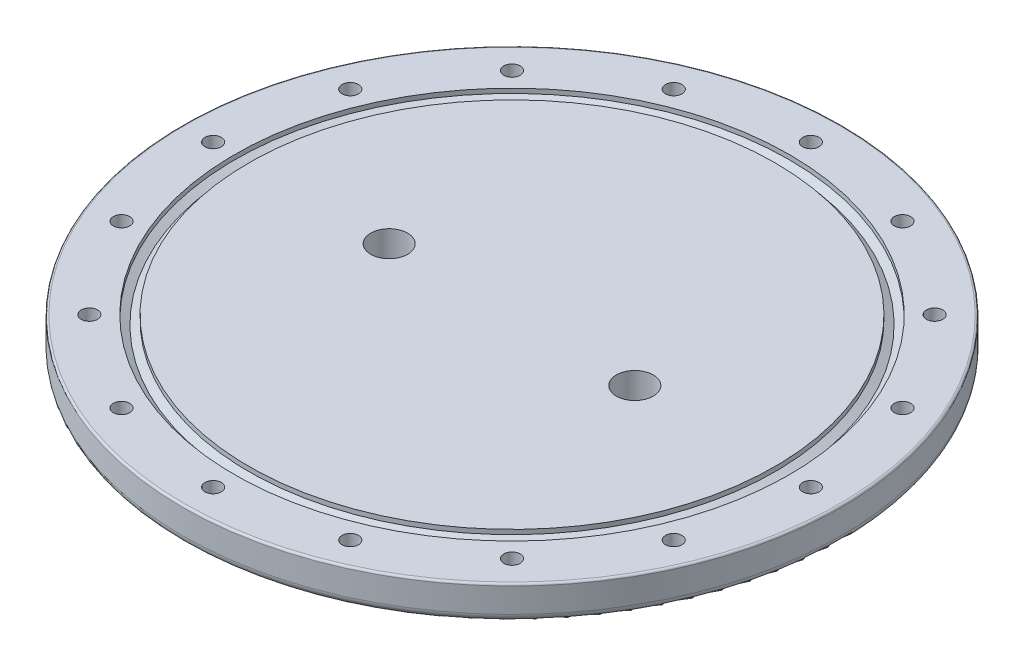
from build123d import *

# Parameters (mm, degrees)
SKETCH1_R           = 80.5
BOSS_EXTRUDE1_DEPTH = 8.5
CUT_EXTRUDE1_REACH  = 116.161
SKETCH2_R           = 2
CUT_EXTRUDE2_REACH  = 116.161
SKETCH5_R           = 4.5
FILLET1_R           = 2
FILLET2_R           = 0.5


with BuildPart() as part:
    # Sketch1 → Boss-Extrude1 (new body)
    with BuildSketch(Plane(origin=(0, 0, 0), x_dir=(1, 0, 0), z_dir=(0, 1, 0))):
        Circle(SKETCH1_R)
    extrude(amount=BOSS_EXTRUDE1_DEPTH)

    # Sketch2 → Cut-Extrude1 (cut, up to next)
    with BuildSketch(Plane(origin=(0, 8.5, 0), x_dir=(1, 0, 0), z_dir=(0, 1, 0)), mode=Mode.PRIVATE) as cut_extrude1_sk1:
        with Locations((0, 73)):
            Circle(SKETCH2_R)
    cut_extrude1_tool1 = extrude(cut_extrude1_sk1.sketch, amount=-CUT_EXTRUDE1_REACH, mode=Mode.PRIVATE) & part.part
    # Sketch2 → Cut-Extrude1 (cut, up to next)
    with BuildSketch(Plane(origin=(0, 8.5, 0), x_dir=(1, 0, 0), z_dir=(0, 1, 0)), mode=Mode.PRIVATE) as cut_extrude1_sk2:
        with Locations((27.935890563, 67.443205873)):
            Circle(SKETCH2_R)
    cut_extrude1_tool2 = extrude(cut_extrude1_sk2.sketch, amount=-CUT_EXTRUDE1_REACH, mode=Mode.PRIVATE) & part.part
    # Sketch2 → Cut-Extrude1 (cut, up to next)
    with BuildSketch(Plane(origin=(0, 8.5, 0), x_dir=(1, 0, 0), z_dir=(0, 1, 0)), mode=Mode.PRIVATE) as cut_extrude1_sk3:
        with Locations((51.618795027, 51.618795027)):
            Circle(SKETCH2_R)
    cut_extrude1_tool3 = extrude(cut_extrude1_sk3.sketch, amount=-CUT_EXTRUDE1_REACH, mode=Mode.PRIVATE) & part.part
    # Sketch2 → Cut-Extrude1 (cut, up to next)
    with BuildSketch(Plane(origin=(0, 8.5, 0), x_dir=(1, 0, 0), z_dir=(0, 1, 0)), mode=Mode.PRIVATE) as cut_extrude1_sk4:
        with Locations((67.443205873, 27.935890563)):
            Circle(SKETCH2_R)
    cut_extrude1_tool4 = extrude(cut_extrude1_sk4.sketch, amount=-CUT_EXTRUDE1_REACH, mode=Mode.PRIVATE) & part.part
    # Sketch2 → Cut-Extrude1 (cut, up to next)
    with BuildSketch(Plane(origin=(0, 8.5, 0), x_dir=(1, 0, 0), z_dir=(0, 1, 0)), mode=Mode.PRIVATE) as cut_extrude1_sk5:
        with Locations((73, 0)):
            Circle(SKETCH2_R)
    cut_extrude1_tool5 = extrude(cut_extrude1_sk5.sketch, amount=-CUT_EXTRUDE1_REACH, mode=Mode.PRIVATE) & part.part
    # Sketch2 → Cut-Extrude1 (cut, up to next)
    with BuildSketch(Plane(origin=(0, 8.5, 0), x_dir=(1, 0, 0), z_dir=(0, 1, 0)), mode=Mode.PRIVATE) as cut_extrude1_sk6:
        with Locations((67.443205873, -27.935890563)):
            Circle(SKETCH2_R)
    cut_extrude1_tool6 = extrude(cut_extrude1_sk6.sketch, amount=-CUT_EXTRUDE1_REACH, mode=Mode.PRIVATE) & part.part
    # Sketch2 → Cut-Extrude1 (cut, up to next)
    with BuildSketch(Plane(origin=(0, 8.5, 0), x_dir=(1, 0, 0), z_dir=(0, 1, 0)), mode=Mode.PRIVATE) as cut_extrude1_sk7:
        with Locations((51.618795027, -51.618795027)):
            Circle(SKETCH2_R)
    cut_extrude1_tool7 = extrude(cut_extrude1_sk7.sketch, amount=-CUT_EXTRUDE1_REACH, mode=Mode.PRIVATE) & part.part
    # Sketch2 → Cut-Extrude1 (cut, up to next)
    with BuildSketch(Plane(origin=(0, 8.5, 0), x_dir=(1, 0, 0), z_dir=(0, 1, 0)), mode=Mode.PRIVATE) as cut_extrude1_sk8:
        with Locations((27.935890563, -67.443205873)):
            Circle(SKETCH2_R)
    cut_extrude1_tool8 = extrude(cut_extrude1_sk8.sketch, amount=-CUT_EXTRUDE1_REACH, mode=Mode.PRIVATE) & part.part
    # Sketch2 → Cut-Extrude1 (cut, up to next)
    with BuildSketch(Plane(origin=(0, 8.5, 0), x_dir=(1, 0, 0), z_dir=(0, 1, 0)), mode=Mode.PRIVATE) as cut_extrude1_sk9:
        with Locations((0, -73)):
            Circle(SKETCH2_R)
    cut_extrude1_tool9 = extrude(cut_extrude1_sk9.sketch, amount=-CUT_EXTRUDE1_REACH, mode=Mode.PRIVATE) & part.part
    # Sketch2 → Cut-Extrude1 (cut, up to next)
    with BuildSketch(Plane(origin=(0, 8.5, 0), x_dir=(1, 0, 0), z_dir=(0, 1, 0)), mode=Mode.PRIVATE) as cut_extrude1_sk10:
        with Locations((-27.935890563, -67.443205873)):
            Circle(SKETCH2_R)
    cut_extrude1_tool10 = extrude(cut_extrude1_sk10.sketch, amount=-CUT_EXTRUDE1_REACH, mode=Mode.PRIVATE) & part.part
    # Sketch2 → Cut-Extrude1 (cut, up to next)
    with BuildSketch(Plane(origin=(0, 8.5, 0), x_dir=(1, 0, 0), z_dir=(0, 1, 0)), mode=Mode.PRIVATE) as cut_extrude1_sk11:
        with Locations((-51.618795027, -51.618795027)):
            Circle(SKETCH2_R)
    cut_extrude1_tool11 = extrude(cut_extrude1_sk11.sketch, amount=-CUT_EXTRUDE1_REACH, mode=Mode.PRIVATE) & part.part
    # Sketch2 → Cut-Extrude1 (cut, up to next)
    with BuildSketch(Plane(origin=(0, 8.5, 0), x_dir=(1, 0, 0), z_dir=(0, 1, 0)), mode=Mode.PRIVATE) as cut_extrude1_sk12:
        with Locations((-67.443205873, -27.935890563)):
            Circle(SKETCH2_R)
    cut_extrude1_tool12 = extrude(cut_extrude1_sk12.sketch, amount=-CUT_EXTRUDE1_REACH, mode=Mode.PRIVATE) & part.part
    # Sketch2 → Cut-Extrude1 (cut, up to next)
    with BuildSketch(Plane(origin=(0, 8.5, 0), x_dir=(1, 0, 0), z_dir=(0, 1, 0)), mode=Mode.PRIVATE) as cut_extrude1_sk13:
        with Locations((-73, 0)):
            Circle(SKETCH2_R)
    cut_extrude1_tool13 = extrude(cut_extrude1_sk13.sketch, amount=-CUT_EXTRUDE1_REACH, mode=Mode.PRIVATE) & part.part
    # Sketch2 → Cut-Extrude1 (cut, up to next)
    with BuildSketch(Plane(origin=(0, 8.5, 0), x_dir=(1, 0, 0), z_dir=(0, 1, 0)), mode=Mode.PRIVATE) as cut_extrude1_sk14:
        with Locations((-67.443205873, 27.935890563)):
            Circle(SKETCH2_R)
    cut_extrude1_tool14 = extrude(cut_extrude1_sk14.sketch, amount=-CUT_EXTRUDE1_REACH, mode=Mode.PRIVATE) & part.part
    # Sketch2 → Cut-Extrude1 (cut, up to next)
    with BuildSketch(Plane(origin=(0, 8.5, 0), x_dir=(1, 0, 0), z_dir=(0, 1, 0)), mode=Mode.PRIVATE) as cut_extrude1_sk15:
        with Locations((-51.618795027, 51.618795027)):
            Circle(SKETCH2_R)
    cut_extrude1_tool15 = extrude(cut_extrude1_sk15.sketch, amount=-CUT_EXTRUDE1_REACH, mode=Mode.PRIVATE) & part.part
    # Sketch2 → Cut-Extrude1 (cut, up to next)
    with BuildSketch(Plane(origin=(0, 8.5, 0), x_dir=(1, 0, 0), z_dir=(0, 1, 0)), mode=Mode.PRIVATE) as cut_extrude1_sk16:
        with Locations((-27.935890563, 67.443205873)):
            Circle(SKETCH2_R)
    cut_extrude1_tool16 = extrude(cut_extrude1_sk16.sketch, amount=-CUT_EXTRUDE1_REACH, mode=Mode.PRIVATE) & part.part
    add(cut_extrude1_tool1.solids().sort_by_distance((0, 8.5, -73))[0], mode=Mode.SUBTRACT)
    add(cut_extrude1_tool2.solids().sort_by_distance((27.935891, 8.5, -67.443206))[0], mode=Mode.SUBTRACT)
    add(cut_extrude1_tool3.solids().sort_by_distance((51.618795, 8.5, -51.618795))[0], mode=Mode.SUBTRACT)
    add(cut_extrude1_tool4.solids().sort_by_distance((67.443206, 8.5, -27.935891))[0], mode=Mode.SUBTRACT)
    add(cut_extrude1_tool5.solids().sort_by_distance((73, 8.5, 0))[0], mode=Mode.SUBTRACT)
    add(cut_extrude1_tool6.solids().sort_by_distance((67.443206, 8.5, 27.935891))[0], mode=Mode.SUBTRACT)
    add(cut_extrude1_tool7.solids().sort_by_distance((51.618795, 8.5, 51.618795))[0], mode=Mode.SUBTRACT)
    add(cut_extrude1_tool8.solids().sort_by_distance((27.935891, 8.5, 67.443206))[0], mode=Mode.SUBTRACT)
    add(cut_extrude1_tool9.solids().sort_by_distance((0, 8.5, 73))[0], mode=Mode.SUBTRACT)
    add(cut_extrude1_tool10.solids().sort_by_distance((-27.935891, 8.5, 67.443206))[0], mode=Mode.SUBTRACT)
    add(cut_extrude1_tool11.solids().sort_by_distance((-51.618795, 8.5, 51.618795))[0], mode=Mode.SUBTRACT)
    add(cut_extrude1_tool12.solids().sort_by_distance((-67.443206, 8.5, 27.935891))[0], mode=Mode.SUBTRACT)
    add(cut_extrude1_tool13.solids().sort_by_distance((-73, 8.5, 0))[0], mode=Mode.SUBTRACT)
    add(cut_extrude1_tool14.solids().sort_by_distance((-67.443206, 8.5, -27.935891))[0], mode=Mode.SUBTRACT)
    add(cut_extrude1_tool15.solids().sort_by_distance((-51.618795, 8.5, -51.618795))[0], mode=Mode.SUBTRACT)
    add(cut_extrude1_tool16.solids().sort_by_distance((-27.935891, 8.5, -67.443206))[0], mode=Mode.SUBTRACT)

    # Sketch5 → Cut-Extrude2 (cut, up to next)
    with BuildSketch(Plane.XZ, mode=Mode.PRIVATE) as cut_extrude2_sk1:
        with Locations((30, 0)):
            Circle(SKETCH5_R)
    cut_extrude2_tool1 = extrude(cut_extrude2_sk1.sketch, amount=-CUT_EXTRUDE2_REACH, mode=Mode.PRIVATE) & part.part
    # Sketch5 → Cut-Extrude2 (cut, up to next)
    with BuildSketch(Plane.XZ, mode=Mode.PRIVATE) as cut_extrude2_sk2:
        with Locations((-30, 0)):
            Circle(SKETCH5_R)
    cut_extrude2_tool2 = extrude(cut_extrude2_sk2.sketch, amount=-CUT_EXTRUDE2_REACH, mode=Mode.PRIVATE) & part.part
    add(cut_extrude2_tool1.solids().sort_by_distance((30, 0, 0))[0], mode=Mode.SUBTRACT)
    add(cut_extrude2_tool2.solids().sort_by_distance((-30, 0, 0))[0], mode=Mode.SUBTRACT)

    # Sketch4 → Cut-Revolve1 (revolve, cut)
    with BuildSketch(Plane.XY):
        Polygon((67.75, 7.380362971), (67.75, 8.5), (64.25, 8.5), (64.25, 7.380362971), (66, 6.37), align=None)
    revolve(axis=Axis((0, 0, 0), (0, 1, 0)), mode=Mode.SUBTRACT)

    # Fillet1
    fillet1_edges = [part.edges().sort_by_distance(p)[0] for p in [
        (-80.5, 0, 0),
    ]]
    fillet(fillet1_edges, radius=FILLET1_R)

    # Fillet2
    fillet2_edges = [part.edges().sort_by_distance(p)[0] for p in [
        (-80.5, 8.5, 0),
    ]]
    fillet(fillet2_edges, radius=FILLET2_R)


solid = part.part
